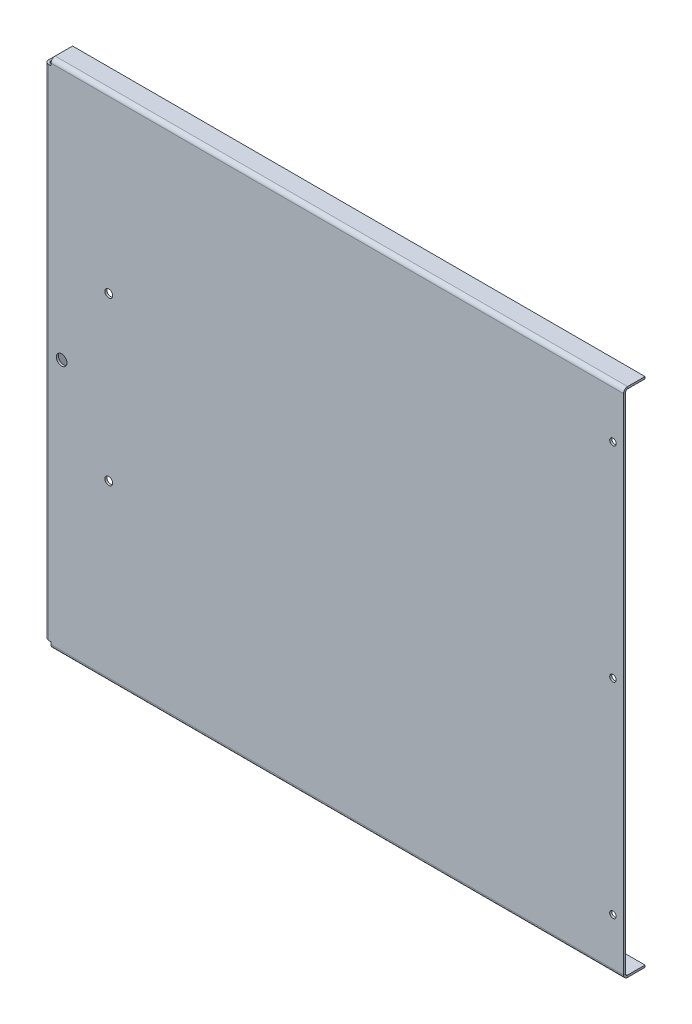
from build123d import *

# Parameters (mm, degrees)
CROQUIS1_W                         = 431.038
CROQUIS1_H                         = 381
BRIDA_BASE1_DEPTH                  = 1.524
CORTAR_EXTRUIR1_REACH              = 289.647
CROQUIS6_W                         = 4.826
CROQUIS6_H                         = 4.826
BRIDA_DE_ARISTA1_STRIP_W           = 9.144
BRIDA_DE_ARISTA1_STRIP_H           = 1.524
BRIDA_DE_ARISTA1_STRIP_CUT_DEPTH   = 426.212
BRIDA_DE_ARISTA1_STRIP_2_W         = 9.144
BRIDA_DE_ARISTA1_STRIP_2_H         = 1.524
BRIDA_DE_ARISTA1_STRIP_CUT_2_DEPTH = 426.212
BRIDA_DE_ARISTA1_STRIP_3_W         = 9.144
BRIDA_DE_ARISTA1_STRIP_3_H         = 1.524
BRIDA_DE_ARISTA1_STRIP_CUT_3_DEPTH = 371.348
BRIDA_DE_ARISTA1_DEPTH             = 426.212
BRIDA_DE_ARISTA1_BEND_DEPTH        = 426.212
BRIDA_DE_ARISTA1_BEND_2_DEPTH      = 371.348
CORTAR_EXTRUIR2_REACH              = 290.088
CROQUIS16_R                        = 3.9624
CROQUIS16_R_2                      = 2.8956
CROQUIS16_R_3                      = 2.413


# Sheet-metal steps are written as plain solids
with BuildPart() as part:
    # Croquis1 → Brida base1 (new body)
    with BuildSketch(Plane.XY):
        Rectangle(CROQUIS1_W, CROQUIS1_H)
    extrude(amount=-BRIDA_BASE1_DEPTH)

    # Croquis6 → Cortar-Extruir1 (cut, up to next)
    with BuildSketch(Plane.XY, mode=Mode.PRIVATE) as cortar_extruir1_sk1:
        with Locations((-213.106, 188.087)):
            Rectangle(CROQUIS6_W, CROQUIS6_H)
    cortar_extruir1_tool1 = extrude(cortar_extruir1_sk1.sketch, amount=-CORTAR_EXTRUIR1_REACH, mode=Mode.PRIVATE) & part.part
    # Croquis6 → Cortar-Extruir1 (cut, up to next)
    with BuildSketch(Plane.XY, mode=Mode.PRIVATE) as cortar_extruir1_sk2:
        with Locations((-213.106, -188.087)):
            Rectangle(CROQUIS6_W, CROQUIS6_H)
    cortar_extruir1_tool2 = extrude(cortar_extruir1_sk2.sketch, amount=-CORTAR_EXTRUIR1_REACH, mode=Mode.PRIVATE) & part.part
    add(cortar_extruir1_tool1.solids().sort_by_distance((-213.106, 188.087, 0))[0], mode=Mode.SUBTRACT)
    add(cortar_extruir1_tool2.solids().sort_by_distance((-213.106, -188.087, 0))[0], mode=Mode.SUBTRACT)

    # Brida de arista1 strip (across the edge) → Brida de arista1 strip cut (cut)
    with BuildSketch(Plane(origin=(-210.693, 190.5, -1.524), x_dir=(0, -1, 0), z_dir=(1, 0, 0))):
        with Locations((-1.524, -0.762)):
            Rectangle(BRIDA_DE_ARISTA1_STRIP_W, BRIDA_DE_ARISTA1_STRIP_H)
    extrude(amount=BRIDA_DE_ARISTA1_STRIP_CUT_DEPTH, mode=Mode.SUBTRACT)

    # Brida de arista1 strip 2 (across the edge) → Brida de arista1 strip cut 2 (cut)
    with BuildSketch(Plane(origin=(215.519, -190.5, -1.524), x_dir=(0, 1, 0), z_dir=(-1, 0, 0))):
        with Locations((-1.524, -0.762)):
            Rectangle(BRIDA_DE_ARISTA1_STRIP_2_W, BRIDA_DE_ARISTA1_STRIP_2_H)
    extrude(amount=BRIDA_DE_ARISTA1_STRIP_CUT_2_DEPTH, mode=Mode.SUBTRACT)

    # Brida de arista1 strip 3 (across the edge) → Brida de arista1 strip cut 3 (cut)
    with BuildSketch(Plane(origin=(-215.519, -185.674, -1.524), x_dir=(1, 0, 0), z_dir=(0, 1, 0))):
        with Locations((-1.524, -0.762)):
            Rectangle(BRIDA_DE_ARISTA1_STRIP_3_W, BRIDA_DE_ARISTA1_STRIP_3_H)
    extrude(amount=BRIDA_DE_ARISTA1_STRIP_CUT_3_DEPTH, mode=Mode.SUBTRACT)

    # Brida de arista1 section (across the edge) → Brida de arista1 (add)
    with BuildSketch(Plane(origin=(-210.693, 190.5, -1.524), x_dir=(0, -1, 0), z_dir=(1, 0, 0))):
        with BuildLine():
            Line((0, 1.524), (0, 14.478))
            Line((0, 14.478), (1.524, 14.478))
            Line((1.524, 14.478), (1.524, 1.524))
            ThreePointArc((1.524, 1.524), (1.970369265, 0.446369265), (3.048, 0))
            Line((3.048, 0), (3.048, -1.524))
            ThreePointArc((3.048, -1.524), (0.892738531, -0.631261469), (0, 1.524))
        make_face()
    extrude(amount=BRIDA_DE_ARISTA1_DEPTH)

    # Brida de arista1 section 2 (across the edge) → Brida de arista1 bend (add)
    with BuildSketch(Plane(origin=(215.519, -190.5, -1.524), x_dir=(0, 1, 0), z_dir=(-1, 0, 0))):
        with BuildLine():
            Line((0, 1.524), (0, 14.478))
            Line((0, 14.478), (1.524, 14.478))
            Line((1.524, 14.478), (1.524, 1.524))
            ThreePointArc((1.524, 1.524), (1.970369265, 0.446369265), (3.048, 0))
            Line((3.048, 0), (3.048, -1.524))
            ThreePointArc((3.048, -1.524), (0.892738531, -0.631261469), (0, 1.524))
        make_face()
    extrude(amount=BRIDA_DE_ARISTA1_BEND_DEPTH)

    # Brida de arista1 section 3 (across the edge) → Brida de arista1 bend 2 (add)
    with BuildSketch(Plane(origin=(-215.519, -185.674, -1.524), x_dir=(1, 0, 0), z_dir=(0, 1, 0))):
        with BuildLine():
            Line((0, 1.524), (0, 14.478))
            Line((0, 14.478), (1.524, 14.478))
            Line((1.524, 14.478), (1.524, 1.524))
            ThreePointArc((1.524, 1.524), (1.970369265, 0.446369265), (3.048, 0))
            Line((3.048, 0), (3.048, -1.524))
            ThreePointArc((3.048, -1.524), (0.892738531, -0.631261469), (0, 1.524))
        make_face()
    extrude(amount=BRIDA_DE_ARISTA1_BEND_2_DEPTH)

    # Croquis16 → Cortar-Extruir2 (cut, up to next)
    with BuildSketch(Plane.XY, mode=Mode.PRIVATE) as cortar_extruir2_sk1:
        with Locations((-202.819, 0)):
            Circle(CROQUIS16_R)
    cortar_extruir2_tool1 = extrude(cortar_extruir2_sk1.sketch, amount=-CORTAR_EXTRUIR2_REACH, mode=Mode.PRIVATE) & part.part
    # Croquis16 → Cortar-Extruir2 (cut, up to next)
    with BuildSketch(Plane.XY, mode=Mode.PRIVATE) as cortar_extruir2_sk2:
        with Locations((-167.767, 60.452)):
            Circle(CROQUIS16_R_2)
    cortar_extruir2_tool2 = extrude(cortar_extruir2_sk2.sketch, amount=-CORTAR_EXTRUIR2_REACH, mode=Mode.PRIVATE) & part.part
    # Croquis16 → Cortar-Extruir2 (cut, up to next)
    with BuildSketch(Plane.XY, mode=Mode.PRIVATE) as cortar_extruir2_sk3:
        with Locations((-167.767, -60.452)):
            Circle(CROQUIS16_R_2)
    cortar_extruir2_tool3 = extrude(cortar_extruir2_sk3.sketch, amount=-CORTAR_EXTRUIR2_REACH, mode=Mode.PRIVATE) & part.part
    # Croquis16 → Cortar-Extruir2 (cut, up to next)
    with BuildSketch(Plane.XY, mode=Mode.PRIVATE) as cortar_extruir2_sk4:
        with Locations((207.645, 152.4)):
            Circle(CROQUIS16_R_3)
    cortar_extruir2_tool4 = extrude(cortar_extruir2_sk4.sketch, amount=-CORTAR_EXTRUIR2_REACH, mode=Mode.PRIVATE) & part.part
    # Croquis16 → Cortar-Extruir2 (cut, up to next)
    with BuildSketch(Plane.XY, mode=Mode.PRIVATE) as cortar_extruir2_sk5:
        with Locations((207.645, 0)):
            Circle(CROQUIS16_R_3)
    cortar_extruir2_tool5 = extrude(cortar_extruir2_sk5.sketch, amount=-CORTAR_EXTRUIR2_REACH, mode=Mode.PRIVATE) & part.part
    # Croquis16 → Cortar-Extruir2 (cut, up to next)
    with BuildSketch(Plane.XY, mode=Mode.PRIVATE) as cortar_extruir2_sk6:
        with Locations((207.645, -152.4)):
            Circle(CROQUIS16_R_3)
    cortar_extruir2_tool6 = extrude(cortar_extruir2_sk6.sketch, amount=-CORTAR_EXTRUIR2_REACH, mode=Mode.PRIVATE) & part.part
    add(cortar_extruir2_tool1.solids().sort_by_distance((-202.819, 0, 0))[0], mode=Mode.SUBTRACT)
    add(cortar_extruir2_tool2.solids().sort_by_distance((-167.767, 60.452, 0))[0], mode=Mode.SUBTRACT)
    add(cortar_extruir2_tool3.solids().sort_by_distance((-167.767, -60.452, 0))[0], mode=Mode.SUBTRACT)
    add(cortar_extruir2_tool4.solids().sort_by_distance((207.645, 152.4, 0))[0], mode=Mode.SUBTRACT)
    add(cortar_extruir2_tool5.solids().sort_by_distance((207.645, 0, 0))[0], mode=Mode.SUBTRACT)
    add(cortar_extruir2_tool6.solids().sort_by_distance((207.645, -152.4, 0))[0], mode=Mode.SUBTRACT)


solid = part.part
